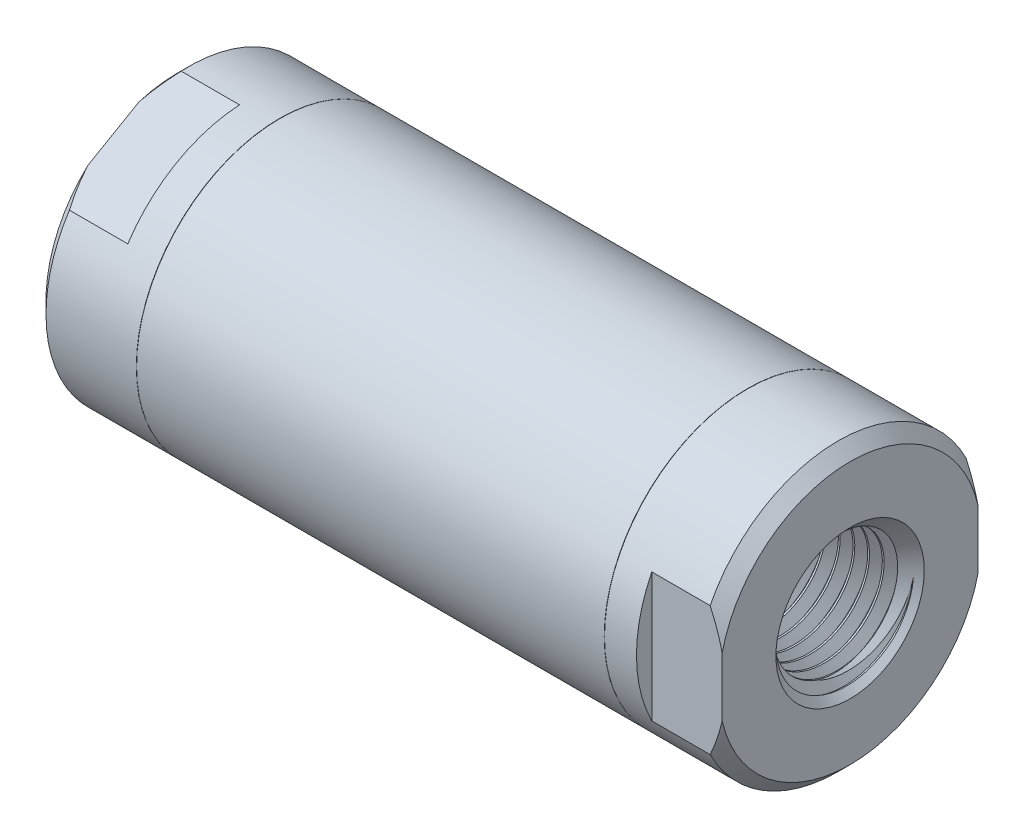
from build123d import *
from build123d.topology import SkipClean

# Parameters (mm, degrees)
CHAMFER1_SIZE          = 1.190625
CHAMFER2_SIZE          = 0.79375
CUT_EXTRUDE1_START     = -6.985
CUT_EXTRUDE1_DEPTH     = 6.985
CUT_EXTRUDE2_DEPTH     = 6.985
CUT_EXTRUDE3_START     = -0.396875
CUT_EXTRUDE3_OUTLINE_R = 2.38125
CUT_EXTRUDE3_DEPTH     = 0.396875
CUT_SWEEP1_PITCH       = 1.411794907
CUT_SWEEP1_HEIGHT      = 11.616831111
CUT_SWEEP1_RADIUS      = 6.858
CUT_SWEEP1_START_ANGLE = -90
CIRPATTERN1_COUNT      = 2


with BuildPart() as part:
    # Sketch3 → Revolve1 (revolve)
    with BuildSketch(Plane.XY, mode=Mode.PRIVATE) as revolve1_sk:
        Polygon((33.401, 5.55625), (33.401, 14.224), (23.241, 14.224), (23.241, 13.589), (23.2156, 13.589), (23.2156, 14.224), (-23.2156, 14.224), (-23.2156, 13.589), (-23.241, 13.589), (-23.241, 14.224), (-33.401, 14.224), (-33.401, 5.55625), (-21.60778, 5.55625), (-21.60778, 5.159375), (-16.84528, 5.159375), (-16.84528, 11.445875), (-12.87653, 11.445875), (-12.87653, 11.049), (10.779125, 11.049), (10.779125, 0), (11.176, 0), (11.176, 11.049), (16.84528, 11.049), (16.84528, 5.159375), (21.60778, 5.159375), (21.60778, 5.55625), align=None)
    revolve(revolve1_sk.sketch.rotate(Axis((-33.401, 0, 0), (1, 0, 0)), 90), axis=Axis((-33.401, 0, 0), (1, 0, 0)))

    # Chamfer1
    chamfer1_edges = [part.edges().sort_by_distance(p)[0] for p in [
        (-33.401, 0, -14.224),
        (33.401, 0, -14.224),
    ]]
    chamfer(chamfer1_edges, length=CHAMFER1_SIZE)

    # Chamfer2
    chamfer2_edges = [part.edges().sort_by_distance(p)[0] for p in [
        (16.84528, 0, -5.159375),
        (-16.84528, 0, -5.159375),
    ]]
    chamfer(chamfer2_edges, length=CHAMFER2_SIZE)

    # Sketch4 → Cut-Extrude1 (cut)
    with BuildSketch(Plane(origin=(33.401, 0, 0), x_dir=(0, 0, -1), z_dir=(1, 0, 0)).offset(CUT_EXTRUDE1_START)):
        with BuildLine():
            Line((-12.7, 6.405636268), (-12.7, -6.405636268))
            ThreePointArc((-12.7, -6.405636268), (-14.224, 0), (-12.7, 6.405636268))
        make_face()
        with BuildLine():
            Line((12.7, 6.405636268), (12.7, -6.405636268))
            ThreePointArc((12.7, -6.405636268), (14.224, 0), (12.7, 6.405636268))
        make_face()
    extrude(amount=CUT_EXTRUDE1_DEPTH, mode=Mode.SUBTRACT)

    # Sketch5 → Cut-Extrude2 (cut)
    with BuildSketch(Plane.ZY.offset(33.401)):
        with BuildLine():
            Line((0.802556264, 14.201340762), (11.897443736, 7.795704494))
            ThreePointArc((11.897443736, 7.795704494), (7.112, 12.318345343), (0.802556264, 14.201340762))
        make_face()
        with BuildLine():
            Line((-11.897443736, -7.795704494), (-0.802556264, -14.201340762))
            ThreePointArc((-0.802556264, -14.201340762), (-7.112, -12.318345343), (-11.897443736, -7.795704494))
        make_face()
    extrude(amount=-CUT_EXTRUDE2_DEPTH, mode=Mode.SUBTRACT)

    # Cut-Extrude3: read off the stored shape, not the designer's step
    # Cut-Extrude3 outline → Cut-Extrude3 (cut)
    with SkipClean():  # the faces are left unmerged after this step: merging them gives an invalid solid
        with BuildSketch(Plane(origin=(11.176, 0, 0), x_dir=(0, 0, -1), z_dir=(1, 0, 0)).offset(CUT_EXTRUDE3_START)):
            Circle(CUT_EXTRUDE3_OUTLINE_R)
            with BuildLine():
                ThreePointArc((5.55625, 9.550313447), (0, 11.049), (-5.55625, 9.550313447))
                ThreePointArc((-5.55625, 9.550313447), (0, 5.29417807), (5.55625, 9.550313447))
            make_face()
            with BuildLine():
                ThreePointArc((-9.550313447, -5.55625), (-5.29417807, 0), (-9.550313447, 5.55625))
                ThreePointArc((-9.550313447, 5.55625), (-11.049, 0), (-9.550313447, -5.55625))
            make_face()
            with BuildLine():
                ThreePointArc((9.550313447, -5.55625), (11.049, 0), (9.550313447, 5.55625))
                ThreePointArc((9.550313447, 5.55625), (5.29417807, 0), (9.550313447, -5.55625))
            make_face()
            with BuildLine():
                ThreePointArc((5.55625, -9.550313447), (0, -5.29417807), (-5.55625, -9.550313447))
                ThreePointArc((-5.55625, -9.550313447), (0, -11.049), (5.55625, -9.550313447))
            make_face()
        extrude(amount=CUT_EXTRUDE3_DEPTH, mode=Mode.SUBTRACT)


with BuildPart() as body_2:
    # Sketch7 → Revolve2 (revolve)
    with BuildSketch(Plane.XY):
        with BuildLine():
            Line((-4.060601131, 0), (-18.348101131, 0))
            ThreePointArc((-18.348101131, 0), (-16.100930635, 6.175028107), (-10.410601131, 9.4615))
            Line((-10.410601131, 9.4615), (-10.410601131, 1.5875))
            Line((-10.410601131, 1.5875), (-4.060601131, 1.5875))
            Line((-4.060601131, 1.5875), (-4.060601131, 0))
        make_face()
    revolve(axis=Axis((-4.060601131, 0, 0), (-1, 0, 0)))


with BuildPart() as body_3:
    # Sketch8 → Revolve3 (revolve)
    with BuildSketch(Plane.XY, mode=Mode.PRIVATE) as revolve3_sk:
        Polygon((33.401, 0), (33.401, 6.858), (23.19528, 6.540243957), (23.19528, 0), align=None)
    revolve(revolve3_sk.sketch.rotate(Axis((23.19528, 0, 0), (1, 0, 0)), 180), axis=Axis((23.19528, 0, 0), (1, 0, 0)))

    # Cut-Sweep1: sweep along a helix
    with BuildLine() as cut_sweep1_path:
        # a taper helix: rise per turn along the axis 1.411111111, along the cone's slant (build123d's pitch) 1.411794907
        add(Helix(CUT_SWEEP1_PITCH, CUT_SWEEP1_HEIGHT, CUT_SWEEP1_RADIUS, center=(33.401, 0, 0), direction=(-1, 0, 0), cone_angle=-1.783333333, mode=Mode.PRIVATE).rotate(Axis((33.401, 0, 0), (-1, 0, 0)), CUT_SWEEP1_START_ANGLE))
    # Sketch10 → Cut-Sweep1 (sweep, cut)
    with BuildSketch(Plane.XY):
        Polygon((33.930166667, 5.941456448), (32.871833333, 7.774543552), (35.164888889, 7.774543552), (34.106555556, 5.941456448), align=None)
    sweep(path=cut_sweep1_path.line, is_frenet=True, mode=Mode.SUBTRACT)


with BuildPart() as cirpattern1_1:
    # CirPattern1: pattern copy
    add(body_3.part.rotate(Axis((0, -14.224, 0), (0, 1, 0)), 1 * 360 / CIRPATTERN1_COUNT))


with BuildPart() as part_1:
    add(part.part)

    # Combine1: cut CirPattern1_1, body 3
    add(cirpattern1_1.part, mode=Mode.SUBTRACT)
    add(body_3.part, mode=Mode.SUBTRACT)

    # Cut-Extrude4 cone 1 section (through the dimple's axis) → Cut-Extrude4 (revolve, cut)
    with SkipClean():  # the faces are left unmerged after this step: merging them gives an invalid solid
        with BuildSketch(Plane(origin=(33.401, 0, 0), x_dir=(0, 0, -1), z_dir=(0, 1, 0))):
            Polygon((0, 0), (7.366, 0), (0, 7.366), align=None)
        revolve(axis=Axis((33.401, 0, 0), (-1, 0, 0)), mode=Mode.SUBTRACT)

    # Cut-Extrude5 cone 1 section (through the dimple's axis) → Cut-Extrude5 (revolve, cut)
    with SkipClean():  # the faces are left unmerged after this step: merging them gives an invalid solid
        with BuildSketch(Plane(origin=(-33.401, 0, 0), x_dir=(0, 0, 1), z_dir=(0, 1, 0))):
            Polygon((0, 0), (7.366, 0), (0, 7.366), align=None)
        revolve(axis=Axis((-33.401, 0, 0), (1, 0, 0)), mode=Mode.SUBTRACT)


solid = Compound([body_2.part, part_1.part])
